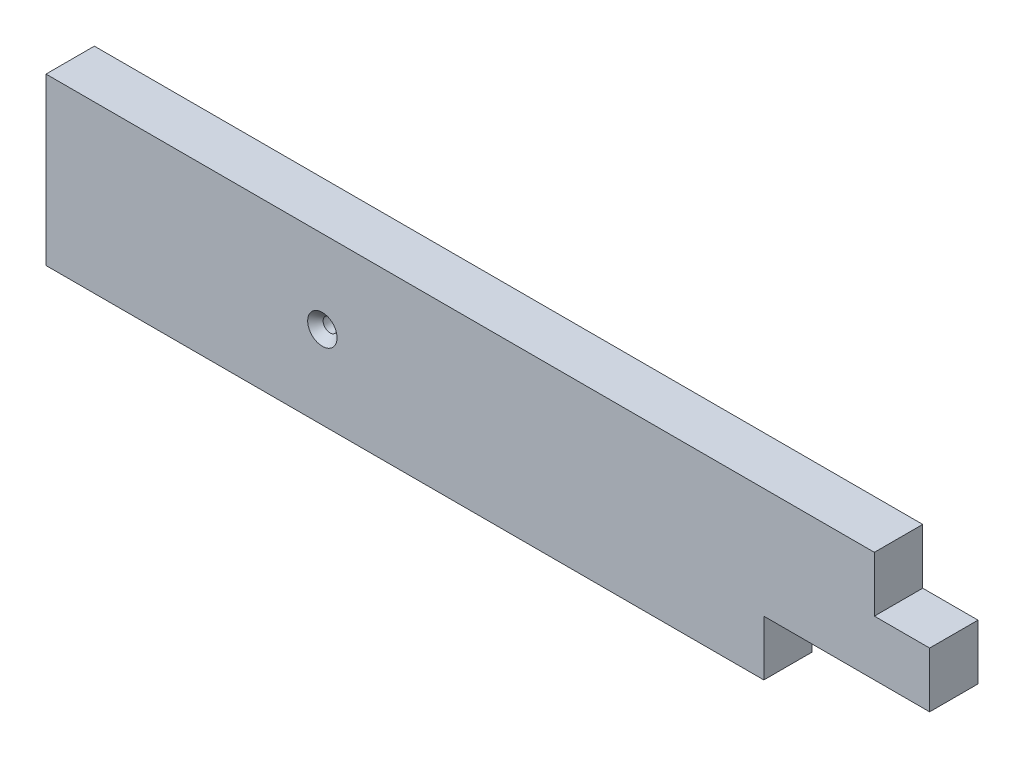
from build123d import *

# Parameters (mm, degrees)
SKETCH1_W                                            = 406.05024073
SKETCH1_H                                            = 22.225
BOSS_EXTRUDE1_DEPTH                                  = 38.1
SKETCH3_W                                            = 25.4
SKETCH3_H                                            = 25.4
SKETCH3_W_2                                          = 76.186487456
CUT_EXTRUDE1_DEPTH                                   = 208.761305647
CSK_FOR_M6_HEX_SOCKET_COUNTERSUNK_HEAD_S_D           = 6.4
CSK_FOR_M6_HEX_SOCKET_COUNTERSUNK_HEAD_S_CSINK_D     = 13.5
CSK_FOR_M6_HEX_SOCKET_COUNTERSUNK_HEAD_S_CSINK_ANGLE = 90


with BuildPart() as part:
    # Sketch1 → Boss-Extrude1 (new, symmetric)
    with BuildSketch(Plane(origin=(0, 0, 0), x_dir=(1, 0, 0), z_dir=(0, 1, 0))):
        Rectangle(SKETCH1_W, SKETCH1_H)
    extrude(amount=BOSS_EXTRUDE1_DEPTH, both=True)

    # Sketch3 → Cut-Extrude1 (cut, through all)
    with BuildSketch(Plane.XY.offset(11.1125)):
        with Locations((190.325120365, 25.4)):
            Rectangle(SKETCH3_W, SKETCH3_H)
        with Locations((164.931876637, -25.4)):
            Rectangle(SKETCH3_W_2, SKETCH3_H)
    extrude(amount=-CUT_EXTRUDE1_DEPTH, mode=Mode.SUBTRACT)

    # CSK for M6 Hex Socket Countersunk Head Screw1 (through all)
    with Locations(Plane.XY.offset(11.1125)):
        with Locations((-76.025120365, 0)):
            CounterSinkHole(CSK_FOR_M6_HEX_SOCKET_COUNTERSUNK_HEAD_S_D / 2, CSK_FOR_M6_HEX_SOCKET_COUNTERSUNK_HEAD_S_CSINK_D / 2, counter_sink_angle=CSK_FOR_M6_HEX_SOCKET_COUNTERSUNK_HEAD_S_CSINK_ANGLE)


solid = part.part
